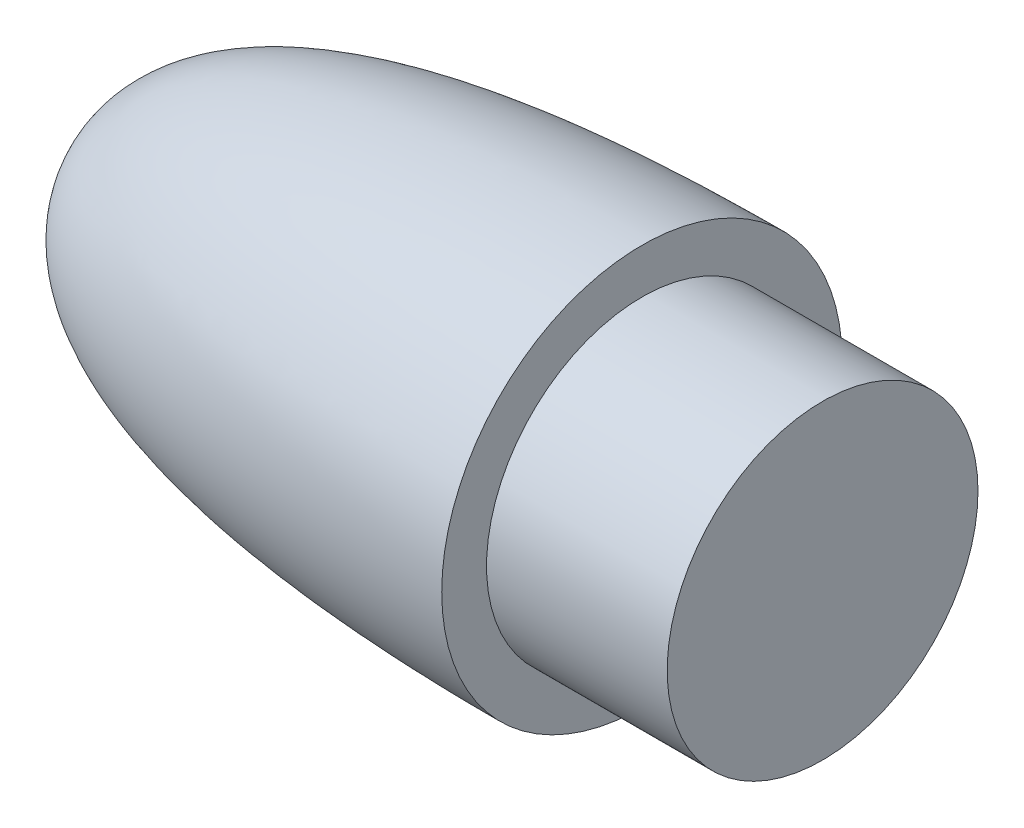
from build123d import *


with BuildPart() as part:
    # Sketch1 → Revolve2 (revolve)
    with BuildSketch(Plane(origin=(0, 0, 0), x_dir=(1, 0, 0), z_dir=(0, 1, 0))):
        with BuildLine():
            Line((-101.6, 21.85), (0, 21.85))
            Line((0, 21.85), (0, 43.7))
            Line((0, 43.7), (-25.4, 43.7))
            Line((-25.4, 43.7), (-25.4, 50))
            add(Edge.make_bspline(
                [(-25.4, 50), (-101.6, 50), (-101.6, 21.85)],
                knots=[0, 0, 0, 1, 1, 1], degree=2))
        make_face()
    revolve(axis=Axis((-25.4, 0, -21.85), (-1, 0, 0)))


solid = part.part
